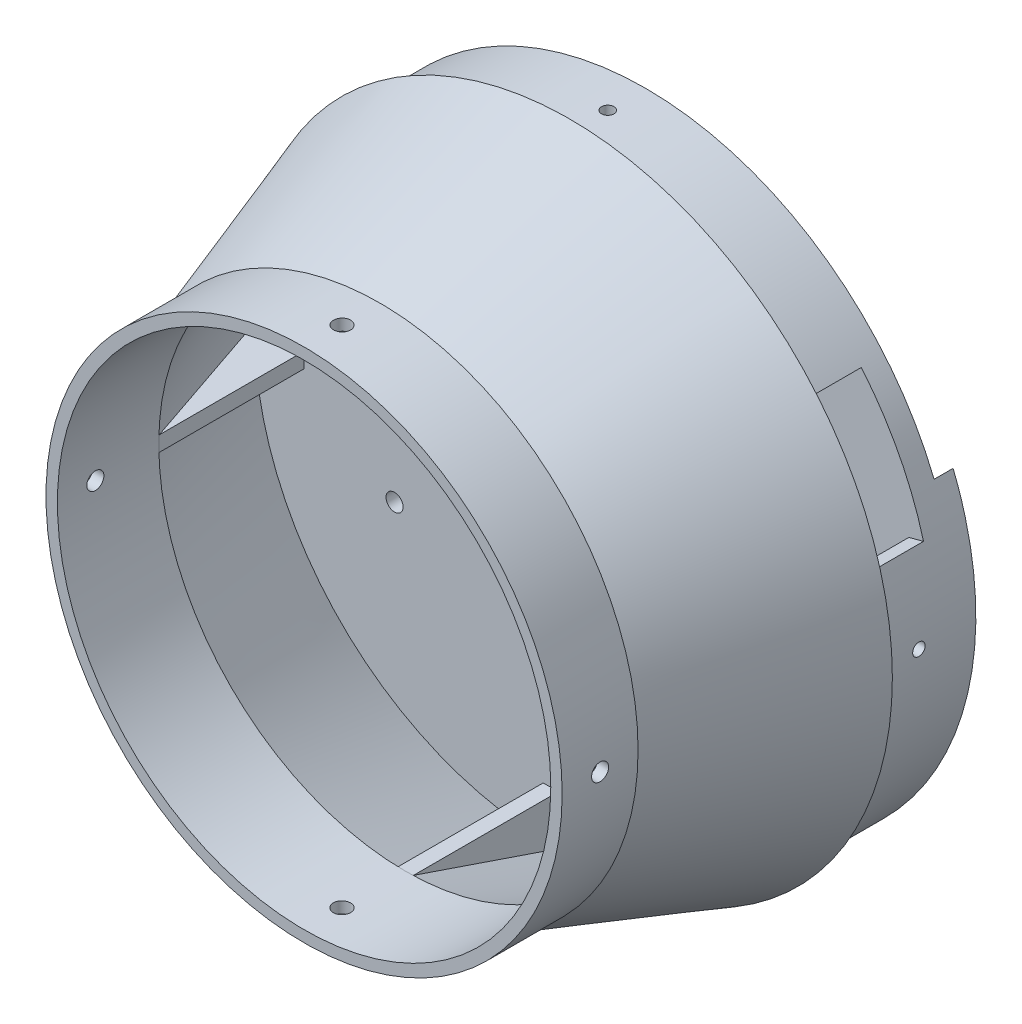
from build123d import *

# Parameters (mm, degrees)
RIB3_REACH                     = 141.104
SKETCH37_WALL_W                = 318.49944201
SKETCH37_WALL_H                = 4
CIRPATTERN3_COUNT              = 4
BOSS_EXTRUDE6_DEPTH            = 20
M4_CLEARANCE_HOLE2_D           = 4.5
M4_CLEARANCE_HOLE2_ON_FACE_2_D = 4.5
M4_CLEARANCE_HOLE2_ON_FACE_3_D = 4.5
M4_CLEARANCE_HOLE2_ON_FACE_4_D = 4.5
M4_CLEARANCE_HOLE1_D           = 4.5
CUT_EXTRUDE7_DEPTH             = 14
RIB4_START                     = -2
RIB4_OUTLINE_W                 = 10
RIB4_OUTLINE_H                 = 14
RIB4_DEPTH                     = 4
CIRPATTERN6_COUNT              = 4
BOSS_EXTRUDE10_START           = 5
BOSS_EXTRUDE10_DEPTH           = 5
CUT_EXTRUDE11_REACH            = 141.104
BOSS_EXTRUDE11_DEPTH           = 12
M3_TAPPED_HOLE1_REACH          = 190.212
M3_TAPPED_HOLE1_BORE_R         = 1.25
M4_TAPPED_HOLE1_D              = 3.3
M4_TAPPED_HOLE1_ON_FACE_2_D    = 3.3
M4_TAPPED_HOLE1_ON_FACE_3_D    = 3.3
M4_TAPPED_HOLE1_ON_FACE_4_D    = 3.3


# Read off the part's stored shape, not the designer's step: Rib4
with BuildPart() as part:
    # Sketch10 → Revolve2 (revolve)
    with BuildSketch(Plane(origin=(0, 0, 0), x_dir=(1, 0, 0), z_dir=(0, 1, 0))):
        Polygon((68, 0), (85, 50), (82, 50), (82, 70), (60, 70), (60, 64), (78, 64), (78, 50), (25, 50), (25, 45), (78.018901629, 45), (65, 6.709112855), (65, -20), (68, -20), align=None)
    revolve(axis=Axis((0, 0, 0), (0, 0, -1)))

    # Sketch37 wall → Rib3 (add, up to next)
    with BuildSketch(Plane(origin=(-65, 0, -25.854556428), x_dir=(0, 0, -1), z_dir=(-1, 0, 0)), mode=Mode.PRIVATE) as rib3_sk1:
        Rectangle(SKETCH37_WALL_W, SKETCH37_WALL_H)
    rib3_tool1 = extrude(rib3_sk1.sketch, amount=RIB3_REACH, mode=Mode.PRIVATE) - part.part
    rib3 = rib3_tool1.solids().sort_by_distance((-65, 0, -25.854556428))[0]
    add(rib3)

    # CirPattern3: Rib3 ×4 about axis
    cirpattern3_axis = Axis((0, 0, 0), (0, 0, 1))
    for i in range(1, CIRPATTERN3_COUNT):
        add(rib3.rotate(cirpattern3_axis, i * 360 / CIRPATTERN3_COUNT))

    # Sketch13 → Boss-Extrude6 (add)
    with BuildSketch(Plane(origin=(0, 0, -50), x_dir=(-1, 0, 0), z_dir=(0, 0, -1))):
        with BuildLine():
            ThreePointArc((82, 0), (78.943017424, 22.181073013), (70, 42.708313008))
            ThreePointArc((70, 42.708313008), (-82, 0), (70, -42.708313008))
            ThreePointArc((70, -42.708313008), (78.943017424, -22.181073013), (82, 0))
        make_face()
        with BuildLine():
            ThreePointArc((70, -34.409301068), (-78, 0), (70, 34.409301068))
            ThreePointArc((70, 34.409301068), (75.973679653, 17.663521733), (78, 0))
            ThreePointArc((78, 0), (75.973679653, -17.663521733), (70, -34.409301068))
        make_face(mode=Mode.SUBTRACT)
    extrude(amount=BOSS_EXTRUDE6_DEPTH)

    # M4 Clearance Hole2 (through all)
    with Locations(Plane(origin=(0, -68, 10), x_dir=(-1, 0, 0), z_dir=(0, -1, 0))):
        with Locations((0, 0)):
            Hole(M4_CLEARANCE_HOLE2_D / 2)

    # M4 Clearance Hole2 on face 2 (through all)
    with Locations(Plane(origin=(-68, 0, 10), x_dir=(0, 0, -1), z_dir=(-1, 0, 0))):
        with Locations((0, 0)):
            Hole(M4_CLEARANCE_HOLE2_ON_FACE_2_D / 2)

    # M4 Clearance Hole2 on face 3 (through all)
    with Locations(Plane(origin=(0, 68, 10), x_dir=(0, 0, 1), z_dir=(0, 1, 0))):
        with Locations((0, 0)):
            Hole(M4_CLEARANCE_HOLE2_ON_FACE_3_D / 2)

    # M4 Clearance Hole2 on face 4 (through all)
    with Locations(Plane(origin=(68, 0, 10), x_dir=(0, 0, 1), z_dir=(1, 0, 0))):
        with Locations((0, 0)):
            Hole(M4_CLEARANCE_HOLE2_ON_FACE_4_D / 2)

    # M4 Clearance Hole1 (through all)
    with Locations(Plane(origin=(0, 0, -50), x_dir=(-1, 0, 0), z_dir=(0, 0, -1))):
        with Locations((-42.868257487, 24.75), (-42.868257487, -24.75), (41.1648925, 23.305662216), (41.1648925, -20.519115646)):
            Hole(M4_CLEARANCE_HOLE1_D / 2)

    # Sketch19 → Cut-Extrude7 (cut)
    with BuildSketch(Plane(origin=(0, 0, -50), x_dir=(-1, 0, 0), z_dir=(0, 0, -1))):
        with BuildLine():
            Line((-75.342214451, 20.187885518), (-79.205917756, 21.223161698))
            ThreePointArc((-79.205917756, 21.223161698), (-72.734888321, 37.863386285), (-62.815644336, 52.708583994))
            Line((-62.815644336, 52.708583994), (-59.751466563, 50.137433556))
            ThreePointArc((-59.751466563, 50.137433556), (-69.186844988, 36.016391832), (-75.342214451, 20.187885518))
        make_face()
        with BuildLine():
            Line((59.751466563, 50.137433556), (62.815644336, 52.708583994))
            ThreePointArc((62.815644336, 52.708583994), (72.734888321, 37.863386285), (79.205917756, 21.223161698))
            Line((79.205917756, 21.223161698), (75.342214451, 20.187885518))
            ThreePointArc((75.342214451, 20.187885518), (69.186844988, 36.016391832), (59.751466563, 50.137433556))
        make_face()
    extrude(amount=CUT_EXTRUDE7_DEPTH, mode=Mode.SUBTRACT)

    # Rib4 outline → Rib4 (add)
    with BuildSketch(Plane(origin=(0, 0, 0), x_dir=(0.7071067811865477, 0.7071067811865475, 0), z_dir=(-0.7071067811865475, 0.7071067811865477, 0)).offset(RIB4_START)):
        with Locations((-73, 57)):
            Rectangle(RIB4_OUTLINE_W, RIB4_OUTLINE_H)
    rib4 = extrude(amount=RIB4_DEPTH)

    # CirPattern6: Rib4 ×4 about axis
    cirpattern6_axis = Axis((0, 0, 0), (0, 0, 1))
    for i in range(1, CIRPATTERN6_COUNT):
        add(rib4.rotate(cirpattern6_axis, i * 360 / CIRPATTERN6_COUNT))

    # Sketch29 → Boss-Extrude10 (add)
    with BuildSketch(Plane(origin=(0, 0, -70), x_dir=(-1, 0, 0), z_dir=(0, 0, -1)).offset(BOSS_EXTRUDE10_START)):
        with BuildLine():
            Line((-76, 1.754194157), (-76, 30.789608637))
            ThreePointArc((-76, 30.789608637), (0, -82), (76, 30.789608637))
            Line((76, 30.789608637), (76, 1.754194157))
            ThreePointArc((76, 1.754194157), (79.069009549, 1.436411602), (80.489460564, -1.302588997))
            ThreePointArc((80.489460564, -1.302588997), (0, -80.5), (-80.489460564, -1.302588997))
            ThreePointArc((-80.489460564, -1.302588997), (-79.069009549, 1.436411602), (-76, 1.754194157))
        make_face()
        with BuildLine():
            ThreePointArc((78.489722413, -1.270226537), (77.260112607, -0.000163656), (75.990049725, -1.229773463))
            ThreePointArc((75.990049725, -1.229773463), (0, -76), (-75.990049725, -1.229773463))
            ThreePointArc((-75.990049725, -1.229773463), (-77.260112607, -0.000163656), (-78.489722413, -1.270226537))
            ThreePointArc((-78.489722413, -1.270226537), (0, -78.5), (78.489722413, -1.270226537))
        make_face()
    extrude(amount=-BOSS_EXTRUDE10_DEPTH)

    # Sketch30 → Cut-Extrude11 (cut, up to next)
    with BuildSketch(Plane(origin=(0, 0, -50), x_dir=(-1, 0, 0), z_dir=(0, 0, -1)), mode=Mode.PRIVATE) as cut_extrude11_sk1:
        with BuildLine():
            Line((-53.623111018, 44.995132678), (-58.98542212, 49.494645946))
            ThreePointArc((-58.98542212, 49.494645946), (-70.478983892, 31.011495119), (-76.341254326, 10.050516801))
            Line((-76.341254326, 10.050516801), (-69.401140296, 9.136833455))
            ThreePointArc((-69.401140296, 9.136833455), (-64.071803538, 28.19226829), (-53.623111018, 44.995132678))
        make_face()
    cut_extrude11_tool1 = extrude(cut_extrude11_sk1.sketch, amount=-CUT_EXTRUDE11_REACH, mode=Mode.PRIVATE) & part.part
    # Sketch30 → Cut-Extrude11 (cut, up to next)
    with BuildSketch(Plane(origin=(0, 0, -50), x_dir=(-1, 0, 0), z_dir=(0, 0, -1)), mode=Mode.PRIVATE) as cut_extrude11_sk2:
        with BuildLine():
            Line((53.623111018, 44.995132678), (58.98542212, 49.494645946))
            ThreePointArc((58.98542212, 49.494645946), (70.478983892, 31.011495119), (76.341254326, 10.050516801))
            Line((76.341254326, 10.050516801), (69.401140296, 9.136833455))
            ThreePointArc((69.401140296, 9.136833455), (64.071803538, 28.19226829), (53.623111018, 44.995132678))
        make_face()
    cut_extrude11_tool2 = extrude(cut_extrude11_sk2.sketch, amount=-CUT_EXTRUDE11_REACH, mode=Mode.PRIVATE) & part.part
    add(cut_extrude11_tool1.solids().sort_by_distance((66.427269, 29.228698, -50))[0], mode=Mode.SUBTRACT)
    add(cut_extrude11_tool2.solids().sort_by_distance((-66.427269, 29.228698, -50))[0], mode=Mode.SUBTRACT)

    # Sketch31 → Boss-Extrude11 (add)
    with BuildSketch(Plane(origin=(0, 0, -50), x_dir=(-1, 0, 0), z_dir=(0, 0, -1))):
        Polygon((-39.129305353, 8.825953921), (-38.252190239, 11.694868189), (-49.72784731, 15.203328646), (-47.681245377, 21.897461937), (-52.462769157, 23.359320461), (-55.386486204, 13.796272901), align=None)
        Polygon((-41.970161197, -14.147281334), (-62.052561072, -8.007475535), (-64.976278119, -17.570523094), (-60.194754339, -19.032381618), (-58.148152406, -12.338248326), (-42.847276311, -17.016195602), align=None)
    boss_extrude11 = extrude(amount=BOSS_EXTRUDE11_DEPTH)

    # M3 Tapped Hole1 bore → M3 Tapped Hole1 (cut, up to next)
    with BuildSketch(Plane(origin=(54.50937109, 16.665187169, 0), x_dir=(0, 0, -1), z_dir=(0.9563047559630348, 0.29237170472273905, 0)), mode=Mode.PRIVATE) as m3_tapped_hole1_sk1:
        with Locations((56.2, -0.65)):
            Circle(M3_TAPPED_HOLE1_BORE_R)
    m3_tapped_hole1_tool1 = extrude(m3_tapped_hole1_sk1.sketch, amount=-M3_TAPPED_HOLE1_REACH, mode=Mode.PRIVATE) & part.part
    # M3 Tapped Hole1 bore → M3 Tapped Hole1 (cut, up to next)
    with BuildSketch(Plane(origin=(54.50937109, 16.665187169, 0), x_dir=(0, 0, -1), z_dir=(0.9563047559630348, 0.29237170472273905, 0)), mode=Mode.PRIVATE) as m3_tapped_hole1_sk2:
        with Locations((56.2, -28.15)):
            Circle(M3_TAPPED_HOLE1_BORE_R)
    m3_tapped_hole1_tool2 = extrude(m3_tapped_hole1_sk2.sketch, amount=-M3_TAPPED_HOLE1_REACH, mode=Mode.PRIVATE) & part.part
    m3_tapped_hole1_1 = m3_tapped_hole1_tool1.solids().sort_by_distance((54.699413, 16.043589, -56.2))[0]
    add(m3_tapped_hole1_1, mode=Mode.SUBTRACT)
    m3_tapped_hole1_2 = m3_tapped_hole1_tool2.solids().sort_by_distance((62.739635, -10.254792, -56.2))[0]
    add(m3_tapped_hole1_2, mode=Mode.SUBTRACT)
    m3_tapped_hole1 = m3_tapped_hole1_1 + m3_tapped_hole1_2  # M3 Tapped Hole1 as one shape, for the pattern or mirror that repeats it

    # Mirror2: Boss-Extrude11, M3 Tapped Hole1 across plane
    add(boss_extrude11.mirror(Plane(origin=(0, 0, 0), x_dir=(0, 0, 1), z_dir=(1, 0, 0))))
    add(m3_tapped_hole1.mirror(Plane(origin=(0, 0, 0), x_dir=(0, 0, 1), z_dir=(1, 0, 0))), mode=Mode.SUBTRACT)

    # M4 Tapped Hole1 (through all)
    with Locations(Plane(origin=(-82, 0, -60), x_dir=(0, -1, 0), z_dir=(-1, 0, 0))):
        with Locations((0, 0)):
            Hole(M4_TAPPED_HOLE1_D / 2)

    # M4 Tapped Hole1 on face 2 (through all)
    with Locations(Plane(origin=(0, 82, -60), x_dir=(0, 0, 1), z_dir=(0, 1, 0))):
        with Locations((0, 0)):
            Hole(M4_TAPPED_HOLE1_ON_FACE_2_D / 2)

    # M4 Tapped Hole1 on face 3 (through all)
    with Locations(Plane(origin=(82, 0, -60), x_dir=(0, 0, 1), z_dir=(1, 0, 0))):
        with Locations((0, 0)):
            Hole(M4_TAPPED_HOLE1_ON_FACE_3_D / 2)

    # M4 Tapped Hole1 on face 4 (through all)
    with Locations(Plane(origin=(0, -82, -60), x_dir=(0, 0, -1), z_dir=(0, -1, 0))):
        with Locations((0, 0)):
            Hole(M4_TAPPED_HOLE1_ON_FACE_4_D / 2)


solid = part.part
